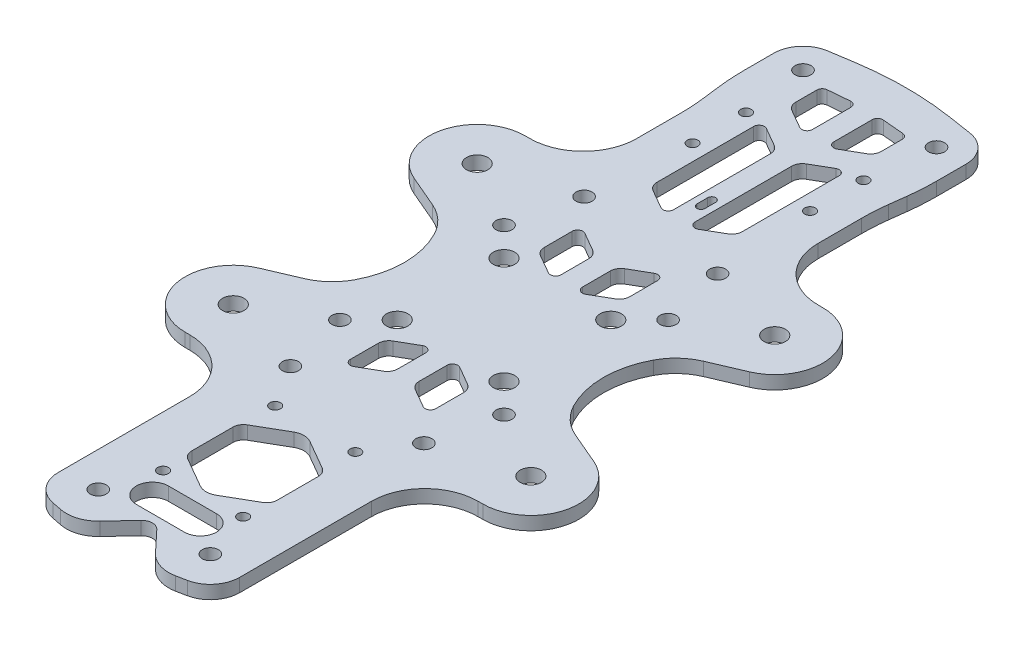
from build123d import *

# Parameters (mm, degrees)
SKETCH2_R           = 1
SKETCH2_R_2         = 1.5
SKETCH2_R_3         = 2
BOSS_EXTRUDE1_DEPTH = 2.5


with BuildPart() as part:
    # Sketch2 → Boss-Extrude1 (new body)
    with BuildSketch(Plane(origin=(0, 0, 0), x_dir=(1, 0, 0), z_dir=(0, 1, 0))):
        with BuildLine():
            Line((13.350883078, 73.933726478), (8.972891286, 74.619286567))
            ThreePointArc((8.972891286, 74.619286567), (-0.00011783, 75.317584084), (-8.973126945, 74.619286567))
            Line((-8.973126945, 74.619286567), (-13.350882829, 73.933763419))
            ThreePointArc((-13.350882829, 73.933763419), (-16.680339328, 72.07414751), (-17.999976849, 68.496158031))
            Line((-17.999976849, 68.496158031), (-17.99612821, 62.986537073))
            ThreePointArc((-17.99612821, 62.986537073), (-17.913159359, 60.376821385), (-17.66818978, 57.777304179))
            Line((-17.66818978, 57.777304179), (-17.287326461, 54.747455148))
            ThreePointArc((-17.287326461, 54.747455148), (-17.064020516, 52.368886066), (-16.990620696, 49.980985546))
            Line((-16.990620696, 49.980985546), (-16.994414065, 41.83534793))
            ThreePointArc((-16.994414065, 41.83534793), (-19.924991835, 34.767290769), (-26.994412981, 31.840004863))
            Line((-26.994412981, 31.840004863), (-27.864354565, 31.840004863))
            ThreePointArc((-27.864354565, 31.840004863), (-36.681216944, 24.646365231), (-31.403561403, 14.565102148))
            Line((-31.403561403, 14.565102148), (-25.40119143, 11.997866062))
            ThreePointArc((-25.40119143, 11.997866062), (-22.55844214, 10.158571988), (-20.492417257, 7.47607923))
            ThreePointArc((-20.492417257, 7.47607923), (-18.638379202, 0), (-20.492417257, -7.47607923))
            ThreePointArc((-20.492417257, -7.47607923), (-22.55844214, -10.158571988), (-25.40119143, -11.997866062))
            Line((-25.40119143, -11.997866062), (-31.403561403, -14.565102148))
            ThreePointArc((-31.403561403, -14.565102148), (-36.681216944, -24.646365231), (-27.864354565, -31.840004863))
            Line((-27.864354565, -31.840004863), (-26.999999944, -31.840004863))
            ThreePointArc((-26.999999944, -31.840004863), (-19.928932149, -34.768937035), (-16.999999944, -41.840004817))
            Line((-16.999999944, -41.840004817), (-16.999999829, -66.500000018))
            ThreePointArc((-16.999999829, -66.500000018), (-15.752129156, -69.988466165), (-12.574764869, -71.89396701))
            Line((-12.574764869, -71.89396701), (-10.754467086, -72.256667119))
            ThreePointArc((-10.754467086, -72.256667119), (-7.748879832, -72.085454613), (-5.204772908, -70.475986245))
            Line((-5.204772908, -70.475986245), (-1.459074237, -66.480574329))
            ThreePointArc((-1.459074237, -66.480574329), (1.71e-07, -65.848456587), (1.45907458, -66.480574329))
            Line((1.45907458, -66.480574329), (5.204773251, -70.475986245))
            ThreePointArc((5.204773251, -70.475986245), (7.748880174, -72.085454613), (10.754467429, -72.256667119))
            Line((10.754467429, -72.256667119), (12.574765212, -71.89396701))
            ThreePointArc((12.574765212, -71.89396701), (15.752129504, -69.988466158), (17.000000171, -66.5))
            Line((17.000000171, -66.5), (17.000000056, -41.84000491))
            ThreePointArc((17.000000056, -41.84000491), (19.928932228, -34.768937068), (27.000000056, -31.840004863))
            Line((27.000000056, -31.840004863), (27.864354565, -31.840004863))
            ThreePointArc((27.864354565, -31.840004863), (36.681216944, -24.646365231), (31.403561403, -14.565102148))
            Line((31.403561403, -14.565102148), (25.40119143, -11.997866062))
            ThreePointArc((25.40119143, -11.997866062), (22.55844214, -10.158571988), (20.492417257, -7.47607923))
            ThreePointArc((20.492417257, -7.47607923), (18.638379202, 0), (20.492417257, 7.47607923))
            ThreePointArc((20.492417257, 7.47607923), (22.55844214, 10.158571988), (25.40119143, 11.997866062))
            Line((25.40119143, 11.997866062), (31.403561403, 14.565102148))
            ThreePointArc((31.403561403, 14.565102148), (36.681216944, 24.646365231), (27.864354565, 31.840004863))
            Line((27.864354565, 31.840004863), (26.994413119, 31.840004863))
            ThreePointArc((26.994413119, 31.840004863), (19.924991932, 34.767290809), (16.994414203, 41.835348045))
            Line((16.994414203, 41.835348045), (16.990620673, 49.981415095))
            ThreePointArc((16.990620673, 49.981415095), (17.064035313, 52.369081916), (17.28732671, 54.747418207))
            Line((17.28732671, 54.747418207), (17.668190029, 57.777267238))
            ThreePointArc((17.668190029, 57.777267238), (17.913159608, 60.376784444), (17.996128459, 62.986500132))
            Line((17.996128459, 62.986500132), (17.999945801, 68.496188877))
            ThreePointArc((17.999945801, 68.496188877), (16.680306987, 72.074134906), (13.350883078, 73.933726478))
        make_face()
        with Locations((-7.5, -35.348457)):
            Circle(SKETCH2_R, mode=Mode.SUBTRACT)
        with Locations((-7.5, -56.348457)):
            Circle(SKETCH2_R, mode=Mode.SUBTRACT)
        with Locations((7.5, -35.348457)):
            Circle(SKETCH2_R, mode=Mode.SUBTRACT)
        with Locations((7.5, -56.348457)):
            Circle(SKETCH2_R, mode=Mode.SUBTRACT)
        with Locations((-11.000072461, 46.317584084)):
            Circle(SKETCH2_R, mode=Mode.SUBTRACT)
        with Locations((10.999927539, 46.317584084)):
            Circle(SKETCH2_R, mode=Mode.SUBTRACT)
        with Locations((10.999927539, 56.317584084)):
            Circle(SKETCH2_R, mode=Mode.SUBTRACT)
        with Locations((-11.000072461, 56.317584084)):
            Circle(SKETCH2_R, mode=Mode.SUBTRACT)
        with Locations((10.500000167, -65.500000004)):
            Circle(SKETCH2_R_2, mode=Mode.SUBTRACT)
        with Locations((-10.499999829, -65.5)):
            Circle(SKETCH2_R_2, mode=Mode.SUBTRACT)
        with Locations((10.000016395, -10.000011804)):
            Circle(SKETCH2_R_3, mode=Mode.SUBTRACT)
        with Locations((15.365, -15.365)):
            Circle(SKETCH2_R_2, mode=Mode.SUBTRACT)
        with Locations((27.864354565, -22.840004863)):
            Circle(SKETCH2_R_3, mode=Mode.SUBTRACT)
        with Locations((12.500000171, -27.5)):
            Circle(SKETCH2_R_2, mode=Mode.SUBTRACT)
        with Locations((-10.000016395, -10.000011804)):
            Circle(SKETCH2_R_3, mode=Mode.SUBTRACT)
        with Locations((-15.365, -15.365)):
            Circle(SKETCH2_R_2, mode=Mode.SUBTRACT)
        with Locations((-12.499999829, -27.5)):
            Circle(SKETCH2_R_2, mode=Mode.SUBTRACT)
        with Locations((-27.864354565, -22.840004863)):
            Circle(SKETCH2_R_3, mode=Mode.SUBTRACT)
        with Locations((27.864354565, 22.840004863)):
            Circle(SKETCH2_R_3, mode=Mode.SUBTRACT)
        with Locations((15.365, 15.365)):
            Circle(SKETCH2_R_2, mode=Mode.SUBTRACT)
        with Locations((10.000016395, 10.000011804)):
            Circle(SKETCH2_R_3, mode=Mode.SUBTRACT)
        with Locations((-10.000016395, 10.000011804)):
            Circle(SKETCH2_R_3, mode=Mode.SUBTRACT)
        with Locations((-15.365, 15.365)):
            Circle(SKETCH2_R_2, mode=Mode.SUBTRACT)
        with Locations((-27.864354565, 22.840004863)):
            Circle(SKETCH2_R_3, mode=Mode.SUBTRACT)
        with Locations((-12.5, 27.5)):
            Circle(SKETCH2_R_2, mode=Mode.SUBTRACT)
        with Locations((12.5, 27.5)):
            Circle(SKETCH2_R_2, mode=Mode.SUBTRACT)
        with Locations((-12.499997086, 68.499999935)):
            Circle(SKETCH2_R_2, mode=Mode.SUBTRACT)
        with Locations((12.500002914, 68.499999467)):
            Circle(SKETCH2_R_2, mode=Mode.SUBTRACT)
        with BuildLine():
            Line((0.749999899, 38.901923806), (0.749999899, 36.901923806))
            ThreePointArc((0.749999899, 36.901923806), (-1.01e-07, 36.151923806), (-0.750000101, 36.901923806))
            Line((-0.750000101, 36.901923806), (-0.750000101, 38.901923806))
            ThreePointArc((-0.750000101, 38.901923806), (-1.01e-07, 39.651923806), (0.749999899, 38.901923806))
        make_face(mode=Mode.SUBTRACT)
        with BuildLine():
            Line((-4.5, -58.348456587), (4.5, -58.348456587))
            ThreePointArc((4.5, -58.348456587), (7.5, -61.348456587), (4.5, -64.348456587))
            Line((4.5, -64.348456587), (-4.5, -64.348456587))
            ThreePointArc((-4.5, -64.348456587), (-7.5, -61.348456587), (-4.5, -58.348456587))
        make_face(mode=Mode.SUBTRACT)
        with BuildLine():
            Line((7, -41.041451884), (1.5, -37.866025404))
            ThreePointArc((1.5, -37.866025404), (0, -37.464101615), (-1.5, -37.866025404))
            Line((-1.5, -37.866025404), (-7, -41.041451884))
            ThreePointArc((-7, -41.041451884), (-7.732050808, -41.773502692), (-8, -42.773502692))
            Line((-8, -42.773502692), (-8, -50.464101615))
            ThreePointArc((-8, -50.464101615), (-7.732050808, -51.464101615), (-7, -52.196152423))
            Line((-7, -52.196152423), (-1.5, -55.371578903))
            ThreePointArc((-1.5, -55.371578903), (0, -55.773502692), (1.5, -55.371578903))
            Line((1.5, -55.371578903), (7, -52.196152423))
            ThreePointArc((7, -52.196152423), (7.732050808, -51.464101615), (8, -50.464101615))
            Line((8, -50.464101615), (8, -42.773502692))
            ThreePointArc((8, -42.773502692), (7.732050808, -41.773502692), (7, -41.041451884))
        make_face(mode=Mode.SUBTRACT)
        with BuildLine():
            Line((2.999999875, -19.613248636), (6.499999844, -21.633974619))
            ThreePointArc((6.499999844, -21.633974619), (7.500547408, -21.634424586), (8.001989831, -20.768600628))
            Line((8.001989831, -20.768600628), (8.011329949, -15.576420031))
            ThreePointArc((8.011329949, -15.576420031), (7.74515233, -14.5758914), (7.014351026, -13.842517334))
            Line((7.014351026, -13.842517334), (3.517878924, -11.815693189))
            ThreePointArc((3.517878924, -11.815693189), (2.517469418, -11.814186451), (2.016370335, -12.680050851))
            Line((2.016370335, -12.680050851), (2.012220809, -17.900793835))
            ThreePointArc((2.012220809, -17.900793835), (2.276502543, -18.889463725), (2.999999875, -19.613248636))
        make_face(mode=Mode.SUBTRACT)
        with BuildLine():
            Line((-6.500000155, -21.633974611), (-3.00000291, -19.61325026))
            ThreePointArc((-3.00000291, -19.61325026), (-2.26349058, -18.877378982), (-1.992712343, -17.872075))
            Line((-1.992712343, -17.872075), (-1.983656412, -12.672108118))
            ThreePointArc((-1.983656412, -12.672108118), (-2.482135392, -11.805233368), (-3.482110435, -11.803490607))
            Line((-3.482110435, -11.803490607), (-6.985627702, -13.818112198))
            ThreePointArc((-6.985627702, -13.818112198), (-7.718918203, -14.548849716), (-7.988598804, -15.548331908))
            Line((-7.988598804, -15.548331908), (-7.997709151, -20.767528161))
            ThreePointArc((-7.997709151, -20.767528161), (-7.499228332, -21.633538561), (-6.500000155, -21.633974611))
        make_face(mode=Mode.SUBTRACT)
        with BuildLine():
            Line((3.517878923, 11.815693192), (7.014351026, 13.842517334))
            ThreePointArc((7.014351026, 13.842517334), (7.74515233, 14.5758914), (8.011329949, 15.576420031))
            Line((8.011329949, 15.576420031), (8.001989831, 20.768600628))
            ThreePointArc((8.001989831, 20.768600628), (7.500547408, 21.634424586), (6.499999844, 21.633974619))
            Line((6.499999844, 21.633974619), (2.999999852, 19.613248675))
            ThreePointArc((2.999999852, 19.613248675), (2.276502504, 18.889463747), (2.012220763, 17.900793835))
            Line((2.012220763, 17.900793835), (2.016370338, 12.680050851))
            ThreePointArc((2.016370338, 12.680050851), (2.517469419, 11.814186454), (3.517878923, 11.815693192))
        make_face(mode=Mode.SUBTRACT)
        with BuildLine():
            Line((-3.00000291, 19.61325026), (-6.500000155, 21.633974611))
            ThreePointArc((-6.500000155, 21.633974611), (-7.499228332, 21.633538561), (-7.997709151, 20.767528161))
            Line((-7.997709151, 20.767528161), (-7.988598804, 15.548331908))
            ThreePointArc((-7.988598804, 15.548331908), (-7.718918202, 14.548849716), (-6.985627702, 13.818112198))
            Line((-6.985627702, 13.818112198), (-3.482110435, 11.803490607))
            ThreePointArc((-3.482110435, 11.803490607), (-2.482135392, 11.805233368), (-1.983656412, 12.672108118))
            Line((-1.983656412, 12.672108118), (-1.992712343, 17.872075))
            ThreePointArc((-1.992712343, 17.872075), (-2.26349058, 18.877378982), (-3.00000291, 19.61325026))
        make_face(mode=Mode.SUBTRACT)
        with BuildLine():
            Line((3.499999899, 32.901923807), (6.999999893, 34.922649745))
            ThreePointArc((6.999999893, 34.922649745), (7.732050697, 35.654700549), (7.999999886, 36.654700545))
            Line((7.999999886, 36.654700545), (7.999999845, 54.767949218))
            ThreePointArc((7.999999845, 54.767949218), (7.499999844, 55.63397462), (6.499999845, 55.633974619))
            Line((6.499999845, 55.633974619), (2.999999852, 53.61324868))
            ThreePointArc((2.999999852, 53.61324868), (2.267949047, 52.881197873), (1.999999857, 51.881197876))
            Line((1.999999857, 51.881197876), (1.999999896, 33.767949211))
            ThreePointArc((1.999999896, 33.767949211), (2.499999898, 32.901923807), (3.499999899, 32.901923807))
        make_face(mode=Mode.SUBTRACT)
        with BuildLine():
            Line((-7.000000107, 34.922649752), (-3.500000101, 32.901923805))
            ThreePointArc((-3.500000101, 32.901923805), (-2.500023539, 32.901923382), (-2.00003416, 33.767927854))
            Line((-2.00003416, 33.767927854), (-2.000000143, 51.881191279))
            ThreePointArc((-2.000000143, 51.881191279), (-2.267949232, 52.881195963), (-3.00000291, 53.61325026))
            Line((-3.00000291, 53.61325026), (-6.500000155, 55.63397461))
            ThreePointArc((-6.500000155, 55.63397461), (-7.500001159, 55.633974031), (-8.000000155, 54.767946888))
            Line((-8.000000155, 54.767946888), (-7.999953523, 36.654615238))
            ThreePointArc((-7.999953523, 36.654615238), (-7.732015654, 35.654664451), (-7.000000107, 34.922649752))
        make_face(mode=Mode.SUBTRACT)
        with BuildLine():
            Line((3.499999898, 58.901923808), (6.999999892, 60.922649745))
            ThreePointArc((6.999999892, 60.922649745), (7.732050701, 61.654700553), (7.999999893, 62.654700553))
            Line((7.999999893, 62.654700553), (7.999999882, 66.594635247))
            ThreePointArc((7.999999882, 66.594635247), (7.737277218, 67.270225453), (7.087155625, 67.590829944))
            Line((7.087155625, 67.590829944), (3.087155624, 67.940784602))
            ThreePointArc((3.087155624, 67.940784602), (2.324409672, 67.68186724), (1.99999988, 66.944589901))
            Line((1.99999988, 66.944589901), (1.999999898, 59.76794921))
            ThreePointArc((1.999999898, 59.76794921), (2.499999899, 58.901923808), (3.499999898, 58.901923808))
        make_face(mode=Mode.SUBTRACT)
        with BuildLine():
            Line((-7.000000108, 60.922649753), (-3.500000102, 58.901923807))
            ThreePointArc((-3.500000102, 58.901923807), (-2.500000101, 58.901923807), (-2.000000102, 59.767949212))
            Line((-2.000000102, 59.767949212), (-2.000000119, 66.9445899))
            ThreePointArc((-2.000000119, 66.9445899), (-2.324409912, 67.681867235), (-3.087155862, 67.940784596))
            Line((-3.087155862, 67.940784596), (-7.087155862, 67.590829942))
            ThreePointArc((-7.087155862, 67.590829942), (-7.737277457, 67.27022545), (-8.00000012, 66.594635241))
            Line((-8.00000012, 66.594635241), (-8.000000107, 62.654700557))
            ThreePointArc((-8.000000107, 62.654700557), (-7.732050914, 61.654700559), (-7.000000108, 60.922649753))
        make_face(mode=Mode.SUBTRACT)
    extrude(amount=BOSS_EXTRUDE1_DEPTH)


solid = part.part
